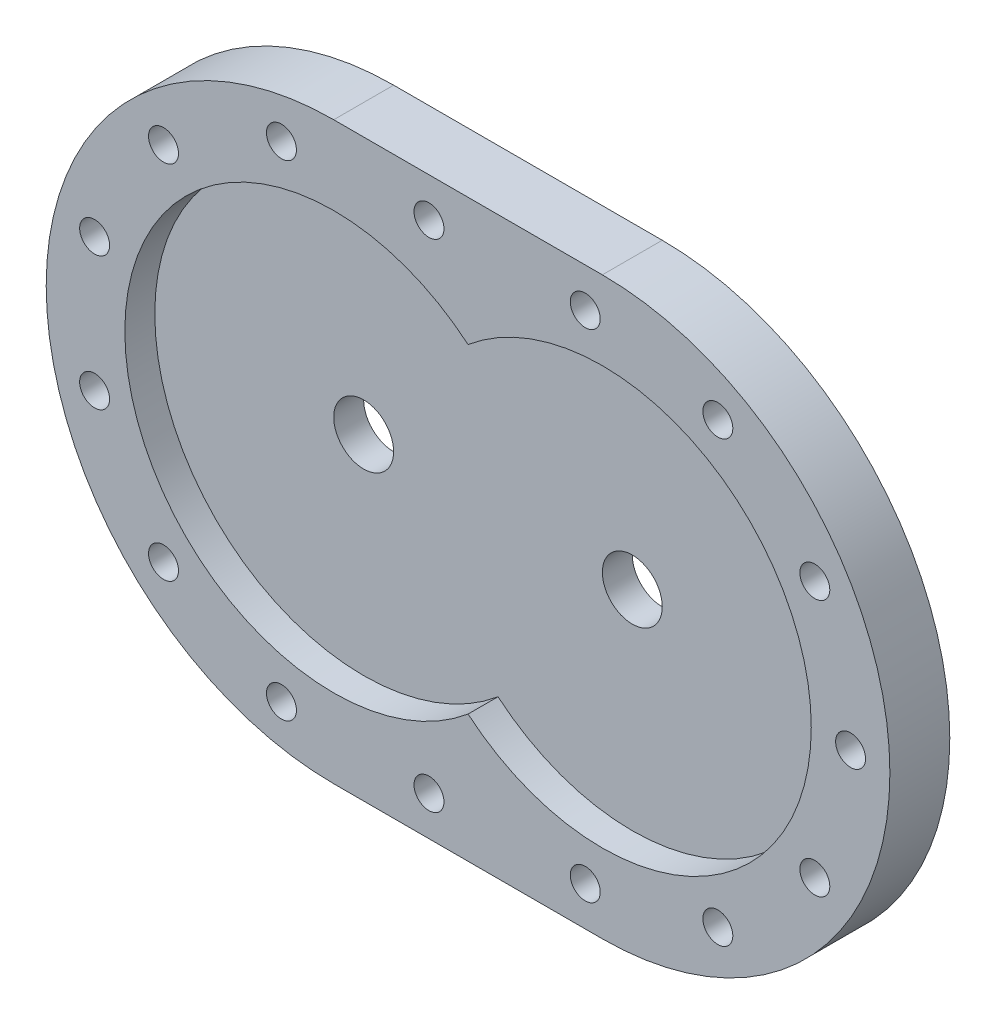
from build123d import *

# Parameters (mm, degrees)
BOSS_EXTRUDE1_DEPTH   = 20
CUT_EXTRUDE1_DEPTH    = 10
SKETCH3_R             = 10
CUT_EXTRUDE2_DEPTH    = 210.276793028
SKETCH4_R             = 5
CUT_EXTRUDE3_DEPTH    = 210.992323907
CRVPATTERN1_START     = -20
CRVPATTERN1_OUTLINE_R = 5
CRVPATTERN1_DEPTH     = 20


# Read off the part's stored shape, not the designer's step: CrvPattern1
with BuildPart() as part:
    # Sketch1 → Boss-Extrude1 (new body)
    with BuildSketch(Plane.XY):
        with BuildLine():
            Line((0, 96), (89.69, 96))
            ThreePointArc((89.69, 96), (185.69, 0), (89.69, -96))
            Line((89.69, -96), (0, -96))
            ThreePointArc((0, -96), (-96, 0), (0, 96))
        make_face()
    extrude(amount=-BOSS_EXTRUDE1_DEPTH)

    # Sketch2 → Cut-Extrude1 (cut)
    with BuildSketch(Plane.XY):
        with BuildLine():
            ThreePointArc((44.845, 53.422733691), (-69.75, 0), (44.845, -53.422733691))
            ThreePointArc((44.845, -53.422733691), (159.44, 0), (44.845, 53.422733691))
        make_face()
    extrude(amount=-CUT_EXTRUDE1_DEPTH, mode=Mode.SUBTRACT)

    # Sketch3 → Cut-Extrude2 (cut, through all)
    with BuildSketch(Plane.XY.offset(-10)):
        Circle(SKETCH3_R)
        with Locations((89.69, 0)):
            Circle(SKETCH3_R)
    extrude(amount=-CUT_EXTRUDE2_DEPTH, mode=Mode.SUBTRACT)

    # Sketch4 → Cut-Extrude3 (cut, through all)
    with BuildSketch(Plane.XY):
        with Locations((172.565, 0)):
            Circle(SKETCH4_R)
    extrude(amount=-CUT_EXTRUDE3_DEPTH, mode=Mode.SUBTRACT)

    # CrvPattern1 outline → CrvPattern1 (cut)
    with BuildSketch(Plane.XY.offset(CRVPATTERN1_START)):
        with Locations((160.625248894, 42.853892348)):
            Circle(CRVPATTERN1_OUTLINE_R)
        with Locations((160.625248894, -42.853892348)):
            Circle(CRVPATTERN1_OUTLINE_R)
        with Locations((128.24630101, -73.359916013)):
            Circle(CRVPATTERN1_OUTLINE_R)
        with Locations((83.973289474, -82.875)):
            Circle(CRVPATTERN1_OUTLINE_R)
        with Locations((31.802236842, -82.875)):
            Circle(CRVPATTERN1_OUTLINE_R)
        with Locations((-17.452379652, -81.01654195)):
            Circle(CRVPATTERN1_OUTLINE_R)
        with Locations((-56.830926836, -60.320074436)):
            Circle(CRVPATTERN1_OUTLINE_R)
        with Locations((-79.834279533, -22.243053668)):
            Circle(CRVPATTERN1_OUTLINE_R)
        with Locations((-79.834279533, 22.243053668)):
            Circle(CRVPATTERN1_OUTLINE_R)
        with Locations((-56.830926836, 60.320074436)):
            Circle(CRVPATTERN1_OUTLINE_R)
        with Locations((-17.452379652, 81.01654195)):
            Circle(CRVPATTERN1_OUTLINE_R)
        with Locations((31.802236842, 82.875)):
            Circle(CRVPATTERN1_OUTLINE_R)
        with Locations((83.973289474, 82.875)):
            Circle(CRVPATTERN1_OUTLINE_R)
        with Locations((128.24630101, 73.359916013)):
            Circle(CRVPATTERN1_OUTLINE_R)
    extrude(amount=CRVPATTERN1_DEPTH, mode=Mode.SUBTRACT)


solid = part.part
